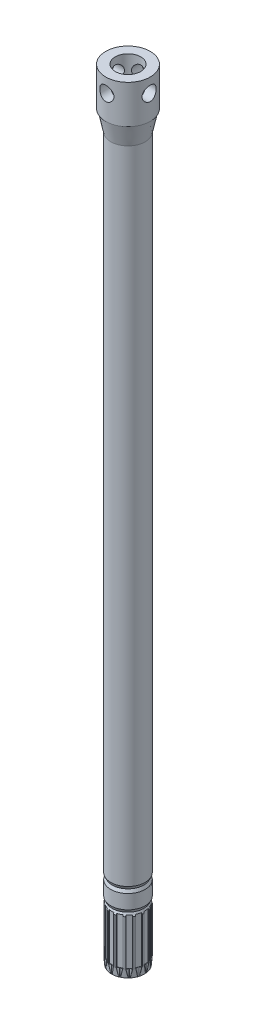
from build123d import *

# Parameters (mm, degrees)
SKETCH3_R            = 10.795
SKETCH3_R_2          = 8.001
BOSS_EXTRUDE1_DEPTH  = 393.7
SKETCH4_R            = 10.795
BOSS_EXTRUDE2_DEPTH  = 12.7
BOSS_EXTRUDE2_DRAFT  = -12
CUT_EXTRUDE1_START   = -50.8
SKETCH6_R            = 8.001
CUT_EXTRUDE1_DEPTH   = 50.8
SKETCH7_R            = 13.97
SKETCH7_R_2          = 8.001
BOSS_EXTRUDE4_DEPTH  = 24.13
SKETCH8_R            = 4.445
CUT_EXTRUDE2_DEPTH   = 50.8
CIRPATTERN1_COUNT    = 2
CIRPATTERN1_ANGLE    = 90
BOSS_EXTRUDE5_START  = 8.89
SKETCH9_R            = 10.795
SKETCH9_R_2          = 8.001
BOSS_EXTRUDE5_DEPTH  = 8.89
SKETCH10_R           = 10.795
BOSS_EXTRUDE6_DEPTH  = 1.905
BOSS_EXTRUDE6_TAPER  = 25
SKETCH11_R           = 8.001
CUT_EXTRUDE3_DEPTH   = 50.8
SKETCH12_R           = 9.906683911
BOSS_EXTRUDE7_DEPTH  = 1.905
BOSS_EXTRUDE7_DRAFT  = -25
SKETCH13_R           = 8.001
CUT_EXTRUDE4_DEPTH   = 50.8
BOSS_EXTRUDE8_START  = 8.89
SKETCH14_R           = 10.795
SKETCH14_R_2         = 8.001
BOSS_EXTRUDE8_DEPTH  = 8.89
SKETCH15_R           = 10.795
BOSS_EXTRUDE9_DEPTH  = 1.905
BOSS_EXTRUDE9_TAPER  = 25
SKETCH16_R           = 8.001
CUT_EXTRUDE5_DEPTH   = 50.8
SKETCH19_R           = 9.906683911
BOSS_EXTRUDE11_DEPTH = 1.905
BOSS_EXTRUDE11_DRAFT = -25
SKETCH20_R           = 8.001
CUT_EXTRUDE6_DEPTH   = 50.8
BOSS_EXTRUDE12_START = 28.448
SKETCH21_R           = 10.795
SKETCH21_R_2         = 8.001
BOSS_EXTRUDE12_DEPTH = 28.448
CUT_EXTRUDE7_START   = 5.08
CUT_EXTRUDE7_DEPTH   = 34.29
CIRPATTERN2_COUNT    = 15
SKETCH23_R           = 10.795
SKETCH23_R_2         = 8.001
BOSS_EXTRUDE13_DEPTH = 5.08
BOSS_EXTRUDE13_DRAFT = 5
FILLET1_R            = 0.254
CUT_EXTRUDE10_DEPTH  = 5.08
CIRPATTERN5_COUNT    = 15
FILLET2_R            = 0.508


with BuildPart() as part:
    # Sketch3 → Boss-Extrude1 (new body)
    with BuildSketch(Plane(origin=(0, 0, 0), x_dir=(1, 0, 0), z_dir=(0, 1, 0))):
        Circle(SKETCH3_R)
        Circle(SKETCH3_R_2, mode=Mode.SUBTRACT)
    extrude(amount=BOSS_EXTRUDE1_DEPTH)


with BuildPart() as boss_extrude2_tool:
    # Sketch4 → Boss-Extrude2 (with draft: the straight prism first)
    with BuildSketch(Plane(origin=(0, 393.7, 0), x_dir=(1, 0, 0), z_dir=(0, 1, 0))):
        Circle(SKETCH4_R)
    extrude(amount=BOSS_EXTRUDE2_DEPTH)
    # Boss-Extrude2: the draft: its side faces are tilted about the plane it starts from
    boss_extrude2_sides = [boss_extrude2_tool.faces().sort_by_distance(p)[0] for p in [
        (-10.795, 400.05, 0),
    ]]
    draft(boss_extrude2_sides, Plane(origin=(0, 393.7, 0), x_dir=(1, 0, 0), z_dir=(0, 1, 0)), BOSS_EXTRUDE2_DRAFT)


with BuildPart() as part_1:
    add(part.part)

    # Boss-Extrude2: add boss_extrude2_tool
    add(boss_extrude2_tool.part)

    # Sketch6 → Cut-Extrude1 (cut)
    with BuildSketch(Plane(origin=(0, 406.4, 0), x_dir=(1, 0, 0), z_dir=(0, 1, 0)).offset(CUT_EXTRUDE1_START)):
        Circle(SKETCH6_R)
    extrude(amount=CUT_EXTRUDE1_DEPTH, mode=Mode.SUBTRACT)

    # Sketch7 → Boss-Extrude4 (add)
    with BuildSketch(Plane(origin=(0, 406.4, 0), x_dir=(1, 0, 0), z_dir=(0, 1, 0))):
        Circle(SKETCH7_R)
        Circle(SKETCH7_R_2, mode=Mode.SUBTRACT)
    extrude(amount=BOSS_EXTRUDE4_DEPTH)

    # Sketch8 → Cut-Extrude2 (cut, symmetric)
    with BuildSketch(Plane(origin=(0, 0, 0), x_dir=(0, 0, -1), z_dir=(1, 0, 0))):
        with Locations((0, 421.64)):
            Circle(SKETCH8_R)
    cut_extrude2 = extrude(amount=CUT_EXTRUDE2_DEPTH, both=True, mode=Mode.SUBTRACT)

    # CirPattern1: Cut-Extrude2 ×2 about axis
    cirpattern1_axis = Axis((0, 430.53, 0), (0, 1, 0))
    for i in range(1, CIRPATTERN1_COUNT):
        add(cut_extrude2.rotate(cirpattern1_axis, i * CIRPATTERN1_ANGLE / (CIRPATTERN1_COUNT - 1)), mode=Mode.SUBTRACT)

    # Sketch9 → Boss-Extrude5 (add)
    with BuildSketch(Plane(origin=(0, 0, 0), x_dir=(-1, 0, 0), z_dir=(0, -1, 0)).offset(BOSS_EXTRUDE5_START)):
        Circle(SKETCH9_R)
        Circle(SKETCH9_R_2, mode=Mode.SUBTRACT)
    extrude(amount=-BOSS_EXTRUDE5_DEPTH)

    # Sketch10 → Boss-Extrude6 (add)
    with BuildSketch(Plane(origin=(0, -8.89, 0), x_dir=(-1, 0, 0), z_dir=(0, -1, 0))):
        Circle(SKETCH10_R)
    extrude(amount=BOSS_EXTRUDE6_DEPTH, taper=BOSS_EXTRUDE6_TAPER)

    # Sketch11 → Cut-Extrude3 (cut)
    with BuildSketch(Plane.XZ.offset(10.795)):
        Circle(SKETCH11_R)
    extrude(amount=-CUT_EXTRUDE3_DEPTH, mode=Mode.SUBTRACT)


with BuildPart() as boss_extrude7_tool:
    # Sketch12 → Boss-Extrude7 (with draft: the straight prism first)
    with BuildSketch(Plane.XZ.offset(10.795)):
        Circle(SKETCH12_R)
    extrude(amount=BOSS_EXTRUDE7_DEPTH)
    # Boss-Extrude7: the draft: its side faces are tilted about the plane it starts from
    boss_extrude7_sides = [boss_extrude7_tool.faces().sort_by_distance(p)[0] for p in [
        (-9.906683911, -11.7475, 0),
    ]]
    draft(boss_extrude7_sides, Plane.XZ.offset(10.795), BOSS_EXTRUDE7_DRAFT)


with BuildPart() as part_2:
    add(part_1.part)

    # Boss-Extrude7: add boss_extrude7_tool
    add(boss_extrude7_tool.part)

    # Sketch13 → Cut-Extrude4 (cut)
    with BuildSketch(Plane.XZ.offset(12.7)):
        Circle(SKETCH13_R)
    extrude(amount=-CUT_EXTRUDE4_DEPTH, mode=Mode.SUBTRACT)

    # Sketch14 → Boss-Extrude8 (add)
    with BuildSketch(Plane.XZ.offset(12.7).offset(BOSS_EXTRUDE8_START)):
        Circle(SKETCH14_R)
        Circle(SKETCH14_R_2, mode=Mode.SUBTRACT)
    extrude(amount=-BOSS_EXTRUDE8_DEPTH)

    # Sketch15 → Boss-Extrude9 (add)
    with BuildSketch(Plane.XZ.offset(21.59)):
        Circle(SKETCH15_R)
    extrude(amount=BOSS_EXTRUDE9_DEPTH, taper=BOSS_EXTRUDE9_TAPER)

    # Sketch16 → Cut-Extrude5 (cut)
    with BuildSketch(Plane.XZ.offset(23.495)):
        Circle(SKETCH16_R)
    extrude(amount=-CUT_EXTRUDE5_DEPTH, mode=Mode.SUBTRACT)


with BuildPart() as boss_extrude11_tool:
    # Sketch19 → Boss-Extrude11 (with draft: the straight prism first)
    with BuildSketch(Plane.XZ.offset(23.495)):
        Circle(SKETCH19_R)
    extrude(amount=BOSS_EXTRUDE11_DEPTH)
    # Boss-Extrude11: the draft: its side faces are tilted about the plane it starts from
    boss_extrude11_sides = [boss_extrude11_tool.faces().sort_by_distance(p)[0] for p in [
        (-9.906683911, -24.4475, 0),
    ]]
    draft(boss_extrude11_sides, Plane.XZ.offset(23.495), BOSS_EXTRUDE11_DRAFT)


with BuildPart() as part_3:
    add(part_2.part)

    # Boss-Extrude11: add boss_extrude11_tool
    add(boss_extrude11_tool.part)

    # Sketch20 → Cut-Extrude6 (cut)
    with BuildSketch(Plane.XZ.offset(25.4)):
        Circle(SKETCH20_R)
    extrude(amount=-CUT_EXTRUDE6_DEPTH, mode=Mode.SUBTRACT)

    # Sketch21 → Boss-Extrude12 (add)
    with BuildSketch(Plane.XZ.offset(25.4).offset(BOSS_EXTRUDE12_START)):
        Circle(SKETCH21_R)
        Circle(SKETCH21_R_2, mode=Mode.SUBTRACT)
    extrude(amount=-BOSS_EXTRUDE12_DEPTH)

    # Sketch22 → Cut-Extrude7 (cut)
    with BuildSketch(Plane.XZ.offset(53.848).offset(CUT_EXTRUDE7_START)):
        with BuildLine():
            Line((-1.524, 10.16), (1.524, 10.16))
            Line((1.524, 10.16), (1.524, 10.686882099))
            ThreePointArc((1.524, 10.686882099), (0, 10.795), (-1.524, 10.686882099))
            Line((-1.524, 10.686882099), (-1.524, 10.16))
        make_face()
    cut_extrude7 = extrude(amount=-CUT_EXTRUDE7_DEPTH, mode=Mode.SUBTRACT)

    # CirPattern2: Cut-Extrude7 ×15 about axis
    cirpattern2_axis = Axis((0, -53.848, 0), (0, 1, 0))
    for i in range(1, CIRPATTERN2_COUNT):
        add(cut_extrude7.rotate(cirpattern2_axis, i * 360 / CIRPATTERN2_COUNT), mode=Mode.SUBTRACT)


with BuildPart() as boss_extrude13_tool:
    # Sketch23 → Boss-Extrude13 (with draft: the straight prism first)
    with BuildSketch(Plane.XZ.offset(53.848)):
        Circle(SKETCH23_R)
        Circle(SKETCH23_R_2, mode=Mode.SUBTRACT)
    extrude(amount=BOSS_EXTRUDE13_DEPTH)
    # Boss-Extrude13: the draft: its side faces are tilted about the plane it starts from
    boss_extrude13_sides = [boss_extrude13_tool.faces().sort_by_distance(p)[0] for p in [
        (-10.795, -56.388, 0),
        (-8.001, -56.388, 0),
    ]]
    draft(boss_extrude13_sides, Plane.XZ.offset(53.848), BOSS_EXTRUDE13_DRAFT)


with BuildPart() as part_4:
    add(part_3.part)

    # Boss-Extrude13: add boss_extrude13_tool
    add(boss_extrude13_tool.part)

    # Fillet1
    fillet1_edges = [part_4.edges().sort_by_distance(p)[0] for p in [
        (-8.493111385, -39.624, -6.663263765),
        (-7.51453359, -39.624, -7.750084511),
        (5.738989827, -39.624, 9.143085954),
        (6.922146088, -39.624, 8.283472613),
        (8.961656177, -39.624, 6.018367185),
        (9.69288696, -39.624, 4.751838316),
        (10.634770759, -39.624, 1.853018055),
        (10.787639619, -39.624, 0.398568006),
        (10.469036863, -39.624, -2.632734731),
        (10.017111385, -39.624, -4.023618334),
        (8.493111385, -39.624, -6.663263765),
        (7.51453359, -39.624, -7.750084511),
        (-4.738956264, -39.243, -9.115397387),
        (-3.71262467, -39.624, -10.136490668),
        (-0.731230783, -39.624, -10.770205501),
        (0.731230783, -39.624, -10.770205501),
        (3.71262467, -39.624, -10.136490668),
        (5.048649791, -39.624, -9.54165396),
        (-1.524, -39.624, 10.686882099),
        (-2.954503272, -39.624, 10.382819242),
        (-5.738989827, -39.624, 9.143085954),
        (-6.922146088, -39.624, 8.283472613),
        (-8.961656177, -39.624, 6.018367185),
        (-9.69288696, -39.624, 4.751838316),
        (-10.634770759, -39.624, 1.853018055),
        (-10.263643835, -39.243, 0.453642182),
        (-10.469036863, -39.624, -2.632734731),
        (-9.560818102, -39.243, -3.760177285),
        (1.524, -39.624, 10.686882099),
        (2.740201016, -39.243, 9.901488494),
    ]]
    fillet(fillet1_edges, radius=FILLET1_R)

    # Sketch24 → Cut-Extrude10 (cut)
    with BuildSketch(Plane.XZ.offset(58.928)):
        with BuildLine():
            Line((-1.524, 10.686882099), (0, 10.224179482))
            Line((0, 10.224179482), (1.524, 10.686882099))
            ThreePointArc((1.524, 10.686882099), (0, 10.795), (-1.524, 10.686882099))
        make_face()
    cut_extrude10 = extrude(amount=-CUT_EXTRUDE10_DEPTH, mode=Mode.SUBTRACT)

    # CirPattern5: Cut-Extrude10 ×15 about axis
    cirpattern5_axis = Axis((0, -58.928, 0), (0, -1, 0))
    for i in range(1, CIRPATTERN5_COUNT):
        add(cut_extrude10.rotate(cirpattern5_axis, i * 360 / CIRPATTERN5_COUNT), mode=Mode.SUBTRACT)

    # Fillet2
    fillet2_edges = [part_4.edges().sort_by_distance(p)[0] for p in [
        (-5.187397032, -56.396363091, 9.211899496),
        (-3.374729322, -56.396363091, 10.018951157),
        (-4.158548441, -56.388, 9.340252724),
        (4.158548441, -56.388, 9.340252724),
        (3.374729322, -56.396363091, 10.018951157),
        (0.992105918, -56.396363091, 10.525393396),
        (0, -56.388, 10.224179482),
        (-0.992105918, -56.396363091, 10.525393396),
        (5.187397032, -56.396363091, 9.211899496),
        (7.158043204, -56.396363091, 7.780141244),
        (8.485740073, -56.396363091, 6.305584486),
        (7.598046077, -56.388, 6.841311416),
        (9.72377252, -56.388, 3.159445213),
        (10.316821564, -56.396363091, 2.308976634),
        (9.703666387, -56.396363091, 4.19607423),
        (10.364030882, -56.396363091, -2.086874255),
        (10.168170357, -56.388, -1.068717769),
        (10.571437496, -56.396363091, -0.113532139),
        (9.611311024, -56.396363091, -4.40350777),
        (8.854399164, -56.388, -5.112089741),
        (8.619205107, -56.396363091, -6.121885626),
        (5.384040465, -56.396363091, -9.098367357),
        (6.009621916, -56.388, -8.271534954),
        (6.98930156, -56.396363091, -7.932076902),
        (3.158778361, -56.396363091, -10.089117878),
        (2.125726443, -56.388, -10.00075663),
        (1.217926314, -56.396363091, -10.501658716),
        (-1.217926314, -56.396363091, -10.501658716),
        (-2.125726443, -56.388, -10.00075663),
        (-3.158778361, -56.396363091, -10.089117878),
        (-5.384040465, -56.396363091, -9.098367357),
        (-6.98930156, -56.396363091, -7.932076902),
        (-6.009621916, -56.388, -8.271534954),
        (-8.854399164, -56.388, -5.112089741),
        (-9.611311024, -56.396363091, -4.40350777),
        (-8.619205107, -56.396363091, -6.121885626),
        (-10.571437496, -56.396363091, -0.113532139),
        (-10.364030882, -56.396363091, -2.086874255),
        (-10.168170357, -56.388, -1.068717769),
        (-10.316821564, -56.396363091, 2.308976634),
        (-9.703666387, -56.396363091, 4.19607423),
        (-9.72377252, -56.388, 3.159445213),
        (-8.485740073, -56.396363091, 6.305584486),
        (-7.158043204, -56.396363091, 7.780141244),
        (-7.598046077, -56.388, 6.841311416),
    ]]
    fillet(fillet2_edges, radius=FILLET2_R)


solid = part_4.part
